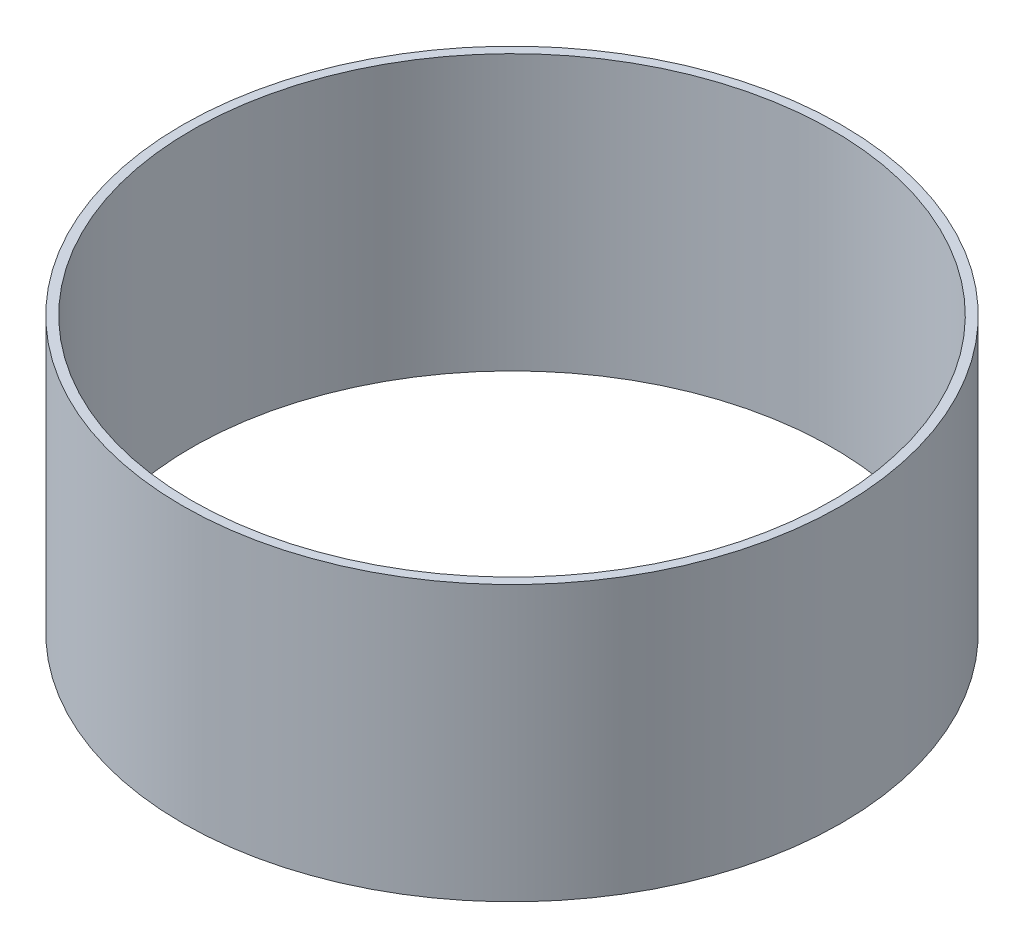
from build123d import *

# Parameters (mm, degrees)
SKETCH1_R           = 36
SKETCH1_R_2         = 35
BOSS_EXTRUDE1_DEPTH = 30


with BuildPart() as part:
    # Sketch1 → Boss-Extrude1 (new body)
    with BuildSketch(Plane(origin=(0, 0, 0), x_dir=(1, 0, 0), z_dir=(0, 1, 0))):
        Circle(SKETCH1_R)
        Circle(SKETCH1_R_2, mode=Mode.SUBTRACT)
    extrude(amount=BOSS_EXTRUDE1_DEPTH)


solid = part.part
